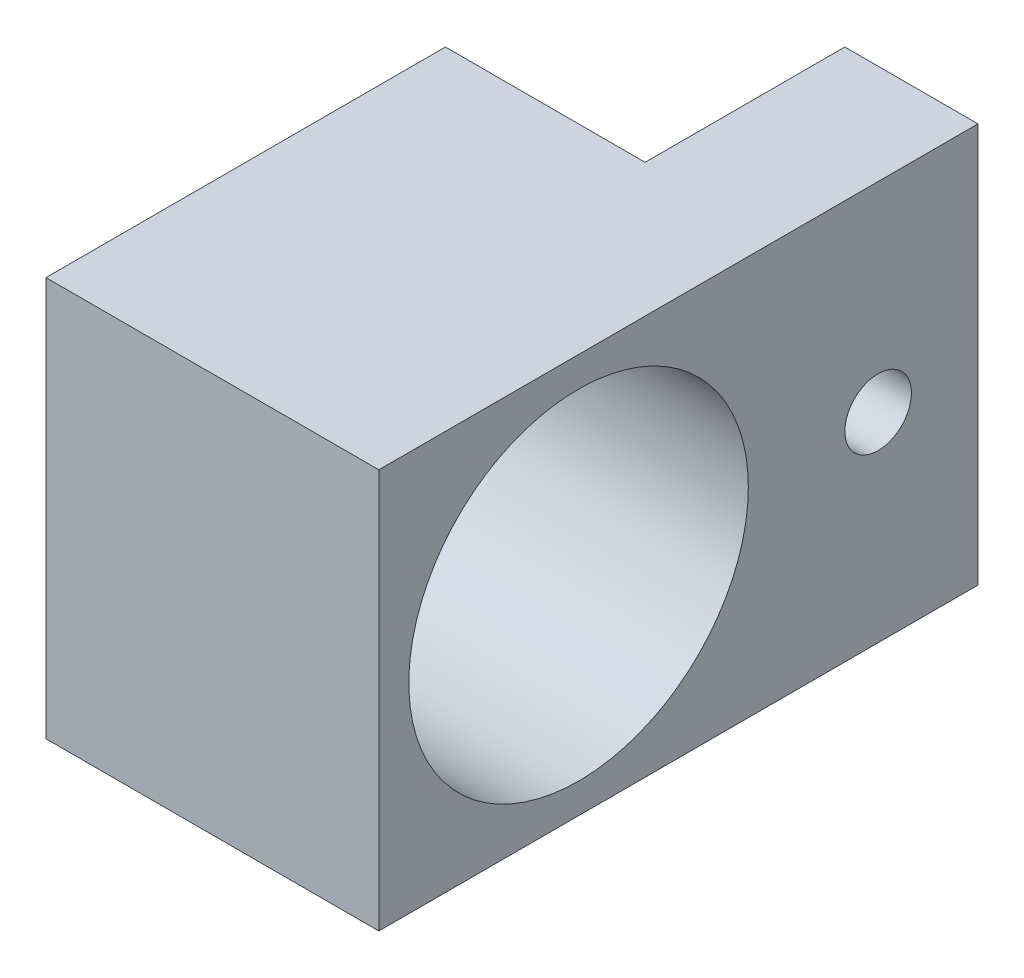
from build123d import *

# Parameters (mm, degrees)
SKETCH1_W           = 30
SKETCH1_H           = 15
BOSS_EXTRUDE1_DEPTH = 30
SKETCH2_W           = 30
SKETCH2_H           = 45
BOSS_EXTRUDE2_DEPTH = 10
SKETCH5_R           = 2.5
CUT_EXTRUDE2_DEPTH  = 50.244289009
SKETCH3_R           = 12.75
CUT_EXTRUDE3_DEPTH  = 50.244289009
SKETCH8_R           = 2.5
CUT_EXTRUDE4_DEPTH  = 10


with BuildPart() as part:
    # Sketch1 → Boss-Extrude1 (new body)
    with BuildSketch(Plane(origin=(0, 0, 0), x_dir=(0, 1, 0), z_dir=(0, 0, 1))):
        with Locations((15, 7.5)):
            Rectangle(SKETCH1_W, SKETCH1_H)
    extrude(amount=BOSS_EXTRUDE1_DEPTH)

    # Sketch2 → Boss-Extrude2 (add)
    with BuildSketch(Plane.YZ):
        with Locations((15, 7.5)):
            Rectangle(SKETCH2_W, SKETCH2_H)
    extrude(amount=BOSS_EXTRUDE2_DEPTH)

    # Sketch5 → Cut-Extrude2 (cut, through all)
    with BuildSketch(Plane.YZ.offset(10)):
        with Locations((15, -7.5)):
            Circle(SKETCH5_R)
    extrude(amount=-CUT_EXTRUDE2_DEPTH, mode=Mode.SUBTRACT)

    # Sketch3 → Cut-Extrude3 (cut, through all)
    with BuildSketch(Plane.YZ.offset(10)):
        with Locations((15, 15)):
            Circle(SKETCH3_R)
    extrude(amount=-CUT_EXTRUDE3_DEPTH, mode=Mode.SUBTRACT)

    # Sketch8 → Cut-Extrude4 (cut)
    with BuildSketch(Plane(origin=(0, 0, 0), x_dir=(1, 0, 0), z_dir=(0, 0, -1))):
        with Locations((-7.5, -15)):
            Circle(SKETCH8_R)
    extrude(amount=-CUT_EXTRUDE4_DEPTH, mode=Mode.SUBTRACT)


solid = part.part
